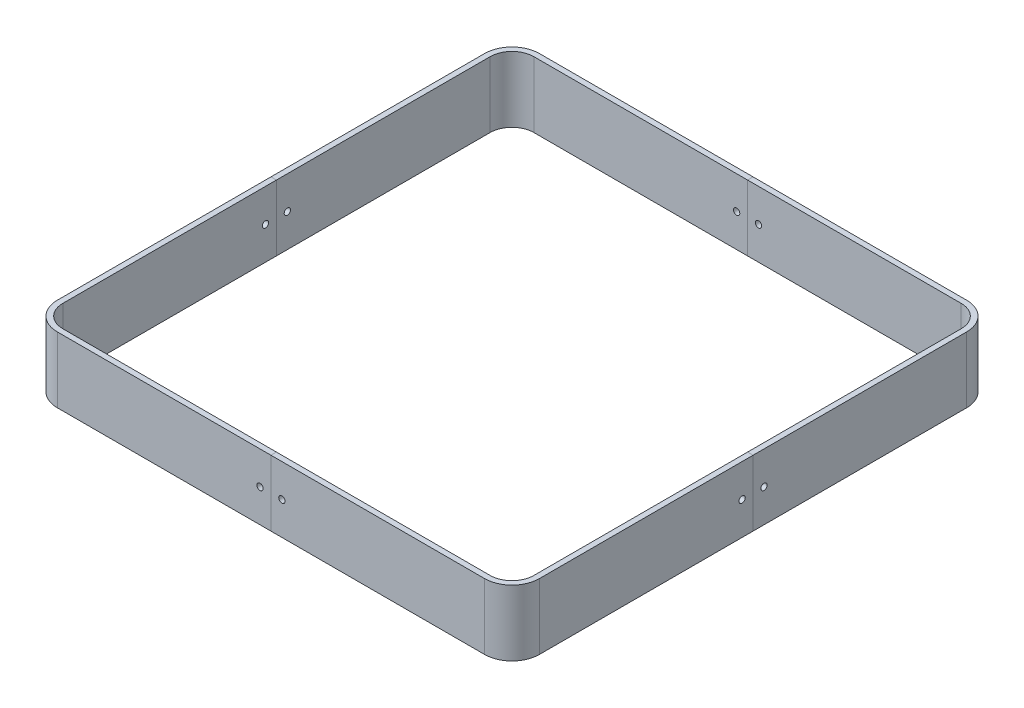
from build123d import *

# Parameters (mm, degrees)
BOSS_EXTRUDE1_DEPTH            = 19.05
SPLIT1_START                   = -19.05
SPLIT1_DEPTH                   = 38.1
SPLIT1_START_2                 = -139.7
SPLIT1_2_OUTLINE_W             = 38.1
SPLIT1_2_OUTLINE_H             = 279.4
SPLIT1_2_DEPTH                 = 139.7
SPLIT1_3_OUTLINE_W             = 38.1
SPLIT1_3_OUTLINE_H             = 139.7
SPLIT1_3_DEPTH                 = 139.7
SPLIT1_4_DEPTH                 = 38.1
SPLIT1_5_DEPTH                 = 38.1
SKETCH6_W                      = 1.8288
SKETCH6_H                      = 279.4
F_6_CLEARANCE_HOLE1_AT_2_COUNT = 2
F_6_CLEARANCE_HOLE1_AT_2_PITCH = 12.7
CIRPATTERN1_COUNT              = 2
CIRPATTERN1_ANGLE              = 90
CIRPATTERN1_COPY_1_SKETCH_W    = 1.8288
CIRPATTERN1_COPY_1_SKETCH_H    = 279.4


# Read off the part's stored shape, not the designer's step: Split1
with BuildPart() as part:
    # Sketch1 → Boss-Extrude1 (new, symmetric)
    with BuildSketch(Plane(origin=(0, 0, 0), x_dir=(1, 0, 0), z_dir=(0, 1, 0))):
        with BuildLine():
            Line((-123.825, 139.7), (123.825, 139.7))
            ThreePointArc((123.825, 139.7), (135.050320151, 135.050320151), (139.7, 123.825))
            Line((139.7, 123.825), (139.7, -123.825))
            ThreePointArc((139.7, -123.825), (135.050320151, -135.050320151), (123.825, -139.7))
            Line((123.825, -139.7), (-123.825, -139.7))
            ThreePointArc((-123.825, -139.7), (-135.050320151, -135.050320151), (-139.7, -123.825))
            Line((-139.7, -123.825), (-139.7, 123.825))
            ThreePointArc((-139.7, 123.825), (-135.050320151, 135.050320151), (-123.825, 139.7))
        make_face()
        with BuildLine():
            Line((-123.825, 136.525), (123.825, 136.525))
            ThreePointArc((123.825, 136.525), (132.805256121, 132.805256121), (136.525, 123.825))
            Line((136.525, 123.825), (136.525, -123.825))
            ThreePointArc((136.525, -123.825), (132.805256121, -132.805256121), (123.825, -136.525))
            Line((123.825, -136.525), (-123.825, -136.525))
            ThreePointArc((-123.825, -136.525), (-132.805256121, -132.805256121), (-136.525, -123.825))
            Line((-136.525, -123.825), (-136.525, 123.825))
            ThreePointArc((-136.525, 123.825), (-132.805256121, 132.805256121), (-123.825, 136.525))
        make_face(mode=Mode.SUBTRACT)
    extrude(amount=BOSS_EXTRUDE1_DEPTH, both=True)

    # Split1 2 outline → Split1 2 (cut)
    with BuildSketch(Plane.YZ.offset(SPLIT1_START_2)):
        Rectangle(SPLIT1_2_OUTLINE_W, SPLIT1_2_OUTLINE_H)
    extrude(amount=SPLIT1_2_DEPTH, mode=Mode.SUBTRACT)

    # Split1 3 outline → Split1 3 (cut)
    with BuildSketch(Plane.YZ):
        with Locations((0, -69.85)):
            Rectangle(SPLIT1_3_OUTLINE_W, SPLIT1_3_OUTLINE_H)
    extrude(amount=SPLIT1_3_DEPTH, mode=Mode.SUBTRACT)


with BuildPart() as body_2:
    # Split1 outline → Split1 (new body)
    with BuildSketch(Plane(origin=(0, 0, 0), x_dir=(1, 0, 0), z_dir=(0, 1, 0)).offset(SPLIT1_START)):
        with BuildLine():
            Line((-123.825, 136.525), (0, 136.525))
            Line((0, 136.525), (0, 139.7))
            Line((0, 139.7), (-123.825, 139.7))
            ThreePointArc((-123.825, 139.7), (-135.050320151, 135.050320151), (-139.7, 123.825))
            Line((-139.7, 123.825), (-139.7, 0))
            Line((-139.7, 0), (-136.525, 0))
            Line((-136.525, 0), (-136.525, 123.825))
            ThreePointArc((-136.525, 123.825), (-132.805256121, 132.805256121), (-123.825, 136.525))
        make_face()
    extrude(amount=SPLIT1_DEPTH)


with BuildPart() as body_3:
    # Split1 4 outline → Split1 4 (new body)
    with BuildSketch(Plane(origin=(0, 0, 0), x_dir=(1, 0, 0), z_dir=(0, 1, 0)).offset(SPLIT1_START)):
        with BuildLine():
            Line((-136.525, 0), (-139.7, 0))
            Line((-139.7, 0), (-139.7, -123.825))
            ThreePointArc((-139.7, -123.825), (-135.050320151, -135.050320151), (-123.825, -139.7))
            Line((-123.825, -139.7), (0, -139.7))
            Line((0, -139.7), (0, -136.525))
            Line((0, -136.525), (-123.825, -136.525))
            ThreePointArc((-123.825, -136.525), (-132.805256121, -132.805256121), (-136.525, -123.825))
            Line((-136.525, -123.825), (-136.525, 0))
        make_face()
    extrude(amount=SPLIT1_4_DEPTH)


with BuildPart() as body_4:
    # Split1 5 outline → Split1 5 (new body)
    with BuildSketch(Plane(origin=(0, 0, 0), x_dir=(1, 0, 0), z_dir=(0, 1, 0)).offset(SPLIT1_START)):
        with BuildLine():
            Line((0, 139.7), (0, 136.525))
            Line((0, 136.525), (123.825, 136.525))
            ThreePointArc((123.825, 136.525), (132.805256121, 132.805256121), (136.525, 123.825))
            Line((136.525, 123.825), (136.525, 0))
            Line((136.525, 0), (139.7, 0))
            Line((139.7, 0), (139.7, 123.825))
            ThreePointArc((139.7, 123.825), (135.050320151, 135.050320151), (123.825, 139.7))
            Line((123.825, 139.7), (0, 139.7))
        make_face()
    extrude(amount=SPLIT1_5_DEPTH)


with BuildPart() as f_6_clearance_hole1_tool:
    # Sketch6 → #6 Clearance Hole1 (revolve)
    with BuildSketch(Plane(origin=(-139.7, 0, 6.35), x_dir=(0, 0, 1), z_dir=(0, 1, 0))):
        with Locations((0.9144, 139.7)):
            Rectangle(SKETCH6_W, SKETCH6_H)
    f_6_clearance_hole1 = revolve(axis=Axis((-146.05, 0, 6.35), (1, 0, 0)))


with BuildPart() as part_1:
    add(part.part)

    # #6 Clearance Hole1: cut by f_6_clearance_hole1_tool
    add(f_6_clearance_hole1_tool.part, mode=Mode.SUBTRACT)


with BuildPart() as body_3_1:
    add(body_3.part)

    # #6 Clearance Hole1: cut by f_6_clearance_hole1_tool
    add(f_6_clearance_hole1_tool.part, mode=Mode.SUBTRACT)


with BuildPart() as f_6_clearance_hole1_at_2_tool:
    # #6 Clearance Hole1 at 2: #6 Clearance Hole1 ×2
    with Locations(*[(0, 0, -i * F_6_CLEARANCE_HOLE1_AT_2_PITCH) for i in range(1, F_6_CLEARANCE_HOLE1_AT_2_COUNT)]):
        add(f_6_clearance_hole1)


with BuildPart() as body_2_1:
    add(body_2.part)

    # #6 Clearance Hole1 at 2: cut by f_6_clearance_hole1_at_2_tool
    add(f_6_clearance_hole1_at_2_tool.part, mode=Mode.SUBTRACT)


with BuildPart() as body_4_1:
    add(body_4.part)

    # #6 Clearance Hole1 at 2: cut by f_6_clearance_hole1_at_2_tool
    add(f_6_clearance_hole1_at_2_tool.part, mode=Mode.SUBTRACT)


with BuildPart() as cirpattern1_tool:
    # CirPattern1: #6 Clearance Hole1 ×2 about axis
    cirpattern1_axis = Axis((0, 20.955, 0), (0, -1, 0))
    for i in range(1, CIRPATTERN1_COUNT):
        add(f_6_clearance_hole1.rotate(cirpattern1_axis, i * CIRPATTERN1_ANGLE / (CIRPATTERN1_COUNT - 1)))


with BuildPart() as body_2_2:
    add(body_2_1.part)

    # CirPattern1: cut by cirpattern1_tool
    add(cirpattern1_tool.part, mode=Mode.SUBTRACT)


with BuildPart() as body_3_2:
    add(body_3_1.part)

    # CirPattern1: cut by cirpattern1_tool
    add(cirpattern1_tool.part, mode=Mode.SUBTRACT)


with BuildPart() as cirpattern1_copy_1_tool:
    # CirPattern1 copy 1 sketch → CirPattern1 copy 1 (revolve)
    with BuildSketch(Plane(origin=(6.35, 0, -139.7), x_dir=(-1, 0, 0), z_dir=(0, 1, 0))):
        with Locations((0.9144, 139.7)):
            Rectangle(CIRPATTERN1_COPY_1_SKETCH_W, CIRPATTERN1_COPY_1_SKETCH_H)
    revolve(axis=Axis((6.35, 0, -146.05), (0, 0, 1)))


with BuildPart() as part_2:
    add(part_1.part)

    # CirPattern1 copy 1: cut by cirpattern1_copy_1_tool
    add(cirpattern1_copy_1_tool.part, mode=Mode.SUBTRACT)


with BuildPart() as body_4_2:
    add(body_4_1.part)

    # CirPattern1 copy 1: cut by cirpattern1_copy_1_tool
    add(cirpattern1_copy_1_tool.part, mode=Mode.SUBTRACT)


solid = Compound([body_2_2.part, body_3_2.part, part_2.part, body_4_2.part])
